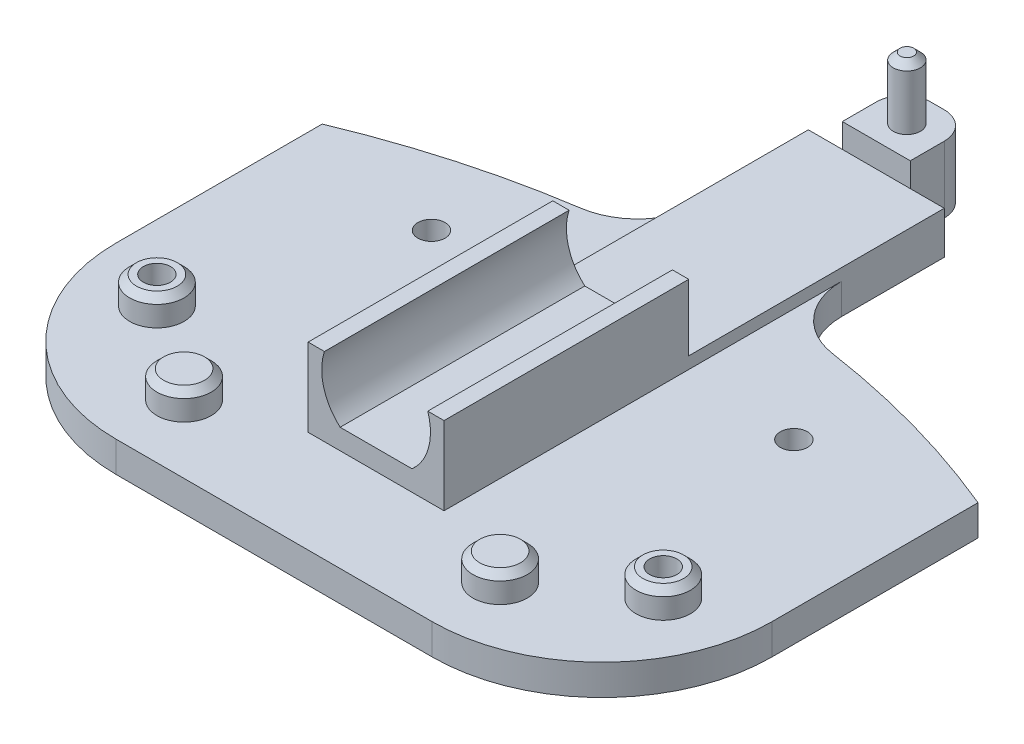
from build123d import *

# Parameters (mm, degrees)
SKETCH1_W           = 96.5
SKETCH1_H           = 110
BOSS_EXTRUDE1_DEPTH = 4.5
SKETCH2_R           = 4
BOSS_EXTRUDE2_DEPTH = 4
SKETCH3_R           = 2
BOSS_EXTRUDE3_DEPTH = 14.4
SKETCH4_W           = 20
SKETCH4_H           = 37.6
BOSS_EXTRUDE4_DEPTH = 1.75
BOSS_EXTRUDE5_DEPTH = 11.5
SKETCH4_5_R         = 2
BOSS_EXTRUDE6_DEPTH = 5.3
CHAMFER2_SIZE       = 1
CUT_EXTRUDE6_DEPTH  = 115.67545509
CHAMFER3_SIZE       = 1
SKETCH2_4_R         = 4
BOSS_EXTRUDE8_DEPTH = 4
CUT_EXTRUDE10_DEPTH = 148.036084007
FILLET1_R           = 10
SKETCH21_R          = 2
CUT_EXTRUDE11_DEPTH = 148.036084007
CHAMFER4_SIZE       = 1
SKETCH22_R          = 2
CUT_EXTRUDE12_DEPTH = 147.698363999
FILLET2_R           = 25


with BuildPart() as part:
    # Sketch1 → Boss-Extrude1 (new body)
    with BuildSketch(Plane(origin=(0, 0, 0), x_dir=(1, 0, 0), z_dir=(0, 1, 0))):
        with Locations((48.25, -55)):
            Rectangle(SKETCH1_W, SKETCH1_H)
    extrude(amount=BOSS_EXTRUDE1_DEPTH)

    # Sketch2 → Boss-Extrude2 (add)
    with BuildSketch(Plane(origin=(0, 4.5, 0), x_dir=(1, 0, 0), z_dir=(0, 1, 0))):
        with Locations((25, -100)):
            Circle(SKETCH2_R)
        with Locations((71.5, -100)):
            Circle(SKETCH2_R)
    extrude(amount=BOSS_EXTRUDE2_DEPTH)

    # Sketch3 → Boss-Extrude3 (add)
    with BuildSketch(Plane(origin=(0, 4.5, 0), x_dir=(1, 0, 0), z_dir=(0, 1, 0))):
        with Locations((48.25, -16.9)):
            Circle(SKETCH3_R)
    extrude(amount=BOSS_EXTRUDE3_DEPTH)

    # Sketch4 → Boss-Extrude4 (add)
    with BuildSketch(Plane(origin=(0, 4.5, 0), x_dir=(1, 0, 0), z_dir=(0, 1, 0))):
        with Locations((48.25, -40.2)):
            Rectangle(SKETCH4_W, SKETCH4_H)
    extrude(amount=BOSS_EXTRUDE4_DEPTH)

    # Sketch4<3> → Boss-Extrude5 (add)
    with BuildSketch(Plane(origin=(0, 4.5, 0), x_dir=(1, 0, 0), z_dir=(0, 1, 0))):
        Polygon((58.25, -59), (48.25, -59), (38.25, -59), (38.25, -95), (58.25, -95), align=None)
    extrude(amount=BOSS_EXTRUDE5_DEPTH)

    # Sketch4<5> → Boss-Extrude6 (add)
    with BuildSketch(Plane(origin=(0, 4.5, 0), x_dir=(1, 0, 0), z_dir=(0, 1, 0))):
        with BuildLine():
            Line((49.25, -12.4), (47.25, -12.4))
            ThreePointArc((47.25, -12.4), (44.421572875, -13.571572875), (43.25, -16.4))
            Line((43.25, -16.4), (43.25, -21.4))
            Line((43.25, -21.4), (53.25, -21.4))
            Line((53.25, -21.4), (53.25, -16.4))
            ThreePointArc((53.25, -16.4), (52.078427125, -13.571572875), (49.25, -12.4))
        make_face()
        with Locations((48.25, -16.9)):
            Circle(SKETCH4_5_R, mode=Mode.SUBTRACT)
    extrude(amount=BOSS_EXTRUDE6_DEPTH)

    # Chamfer2
    chamfer2_edges = [part.edges().sort_by_distance(p)[0] for p in [
        (46.25, 18.9, 16.9),
    ]]
    chamfer(chamfer2_edges, length=CHAMFER2_SIZE)

    # Sketch9 → Cut-Extrude6 (cut, through all)
    with BuildSketch(Plane(origin=(0, 0, 59), x_dir=(-1, 0, 0), z_dir=(0, 0, -1))):
        with BuildLine():
            ThreePointArc((-55.849342077, 16), (-55.970490222, 11.403805654), (-53.541502622, 7.5))
            Line((-53.541502622, 7.5), (-42.958497378, 7.5))
            ThreePointArc((-42.958497378, 7.5), (-40.958497378, 10.208497378), (-40.25, 13.5))
            ThreePointArc((-40.25, 13.5), (-40.350799515, 14.765950905), (-40.650657923, 16))
            Line((-40.650657923, 16), (-55.849342077, 16))
        make_face()
    extrude(amount=-CUT_EXTRUDE6_DEPTH, mode=Mode.SUBTRACT)

    # Chamfer3
    chamfer3_edges = [part.edges().sort_by_distance(p)[0] for p in [
        (67.5, 8.5, 100),
        (21, 8.5, 100),
    ]]
    chamfer(chamfer3_edges, length=CHAMFER3_SIZE)

    # Sketch2<4> → Boss-Extrude8 (add)
    with BuildSketch(Plane(origin=(0, 4.5, 0), x_dir=(1, 0, 0), z_dir=(0, 1, 0))):
        with Locations((11, -90)):
            Circle(SKETCH2_4_R)
        with Locations((85.5, -90)):
            Circle(SKETCH2_4_R)
    extrude(amount=BOSS_EXTRUDE8_DEPTH)

    # Sketch20 → Cut-Extrude10 (cut, through all)
    with BuildSketch(Plane(origin=(0, 4.5, 0), x_dir=(1, 0, 0), z_dir=(0, 1, 0))):
        with BuildLine():
            Line((0, 0), (96.5, 0))
            Line((96.5, 0), (96.5, -54.687652439))
            ThreePointArc((96.5, -54.687652439), (77.742842614, -48.529130099), (58.25, -45.400642056))
            Line((58.25, -45.400642056), (58.25, -21.4))
            Line((58.25, -21.4), (53.25, -21.4))
            Line((53.25, -21.4), (53.25, -16.4))
            ThreePointArc((53.25, -16.4), (52.078427125, -13.571572875), (49.25, -12.4))
            Line((49.25, -12.4), (47.25, -12.4))
            ThreePointArc((47.25, -12.4), (44.421572875, -13.571572875), (43.25, -16.4))
            Line((43.25, -16.4), (43.25, -21.4))
            Line((43.25, -21.4), (38.25, -21.4))
            Line((38.25, -21.4), (38.25, -45.400642056))
            ThreePointArc((38.25, -45.400642056), (18.757157386, -48.529130099), (0, -54.687652439))
            Line((0, -54.687652439), (0, 0))
        make_face()
    extrude(amount=-CUT_EXTRUDE10_DEPTH, mode=Mode.SUBTRACT)

    # Fillet1
    fillet1_edges = [part.edges().sort_by_distance(p)[0] for p in [
        (58.25, 2.25, 45.400642056),
        (38.25, 2.25, 45.400642056),
    ]]
    fillet(fillet1_edges, radius=FILLET1_R)

    # Sketch21 → Cut-Extrude11 (cut, through all)
    with BuildSketch(Plane(origin=(0, 4.5, 0), x_dir=(1, 0, 0), z_dir=(0, 1, 0))):
        with Locations((21.588470277, -60.190333609)):
            Circle(SKETCH21_R)
        with Locations((74.911529723, -60.190333609)):
            Circle(SKETCH21_R)
    extrude(amount=-CUT_EXTRUDE11_DEPTH, mode=Mode.SUBTRACT)

    # Chamfer4
    chamfer4_edges = [part.edges().sort_by_distance(p)[0] for p in [
        (81.5, 8.5, 90),
        (7, 8.5, 90),
    ]]
    chamfer(chamfer4_edges, length=CHAMFER4_SIZE)

    # Sketch22 → Cut-Extrude12 (cut, through all)
    with BuildSketch(Plane(origin=(0, 8.5, 0), x_dir=(1, 0, 0), z_dir=(0, 1, 0))):
        with Locations((11, -90)):
            Circle(SKETCH22_R)
        with Locations((85.5, -90)):
            Circle(SKETCH22_R)
    extrude(amount=-CUT_EXTRUDE12_DEPTH, mode=Mode.SUBTRACT)

    # Fillet2
    fillet2_edges = [part.edges().sort_by_distance(p)[0] for p in [
        (96.5, 2.25, 110),
        (0, 2.25, 110),
    ]]
    fillet(fillet2_edges, radius=FILLET2_R)


solid = part.part
